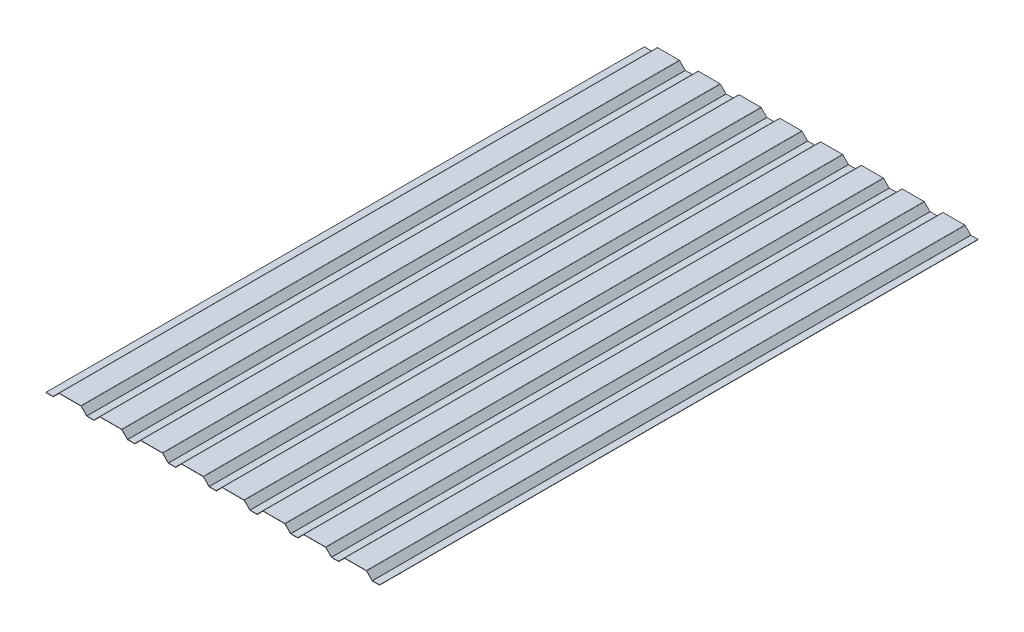
from build123d import *

# Parameters (mm, degrees)
SM_BASE_FLANGE_2_DEPTH = 2054.330661


# Sheet-metal steps are written as plain solids
with BuildPart() as part:
    # Эскиз1 → Базовая кромка2 (new body)
    with BuildSketch(Plane.XY):
        with BuildLine():
            Line((-572.5, 0), (-548.224873734, 0))
            ThreePointArc((-548.224873734, 0), (-547.555177728, 0.133210818), (-546.987436867, 0.512563133))
            Line((-546.987436867, 0.512563133), (-527.719669914, 19.780330086))
            ThreePointArc((-527.719669914, 19.780330086), (-527.476352403, 19.942909649), (-527.189339828, 20))
            Line((-527.189339828, 20), (-452.810660172, 20))
            ThreePointArc((-452.810660172, 20), (-452.523647598, 19.942909649), (-452.280330086, 19.780330086))
            Line((-452.280330086, 19.780330086), (-433.012563133, 0.512563133))
            ThreePointArc((-433.012563133, 0.512563133), (-432.444822272, 0.133210818), (-431.775126266, 0))
            Line((-431.775126266, 0), (-408.224873734, 0))
            ThreePointArc((-408.224873734, 0), (-407.555177728, 0.133210818), (-406.987436867, 0.512563133))
            Line((-406.987436867, 0.512563133), (-387.719669914, 19.780330086))
            ThreePointArc((-387.719669914, 19.780330086), (-387.476352402, 19.942909649), (-387.189339828, 20))
            Line((-387.189339828, 20), (-312.810660172, 20))
            ThreePointArc((-312.810660172, 20), (-312.523647598, 19.942909649), (-312.280330086, 19.780330086))
            Line((-312.280330086, 19.780330086), (-293.012563133, 0.512563133))
            ThreePointArc((-293.012563133, 0.512563133), (-292.444822272, 0.133210818), (-291.775126266, 0))
            Line((-291.775126266, 0), (-268.224873734, 0))
            ThreePointArc((-268.224873734, 0), (-267.555177728, 0.133210818), (-266.987436867, 0.512563133))
            Line((-266.987436867, 0.512563133), (-247.719669914, 19.780330086))
            ThreePointArc((-247.719669914, 19.780330086), (-247.476352402, 19.942909649), (-247.189339828, 20))
            Line((-247.189339828, 20), (-172.810660172, 20))
            ThreePointArc((-172.810660172, 20), (-172.523647598, 19.942909649), (-172.280330086, 19.780330086))
            Line((-172.280330086, 19.780330086), (-153.012563133, 0.512563133))
            ThreePointArc((-153.012563133, 0.512563133), (-152.444822272, 0.133210818), (-151.775126266, 0))
            Line((-151.775126266, 0), (-128.224873734, 0))
            ThreePointArc((-128.224873734, 0), (-127.555177728, 0.133210818), (-126.987436867, 0.512563133))
            Line((-126.987436867, 0.512563133), (-107.719669914, 19.780330086))
            ThreePointArc((-107.719669914, 19.780330086), (-107.476352402, 19.942909649), (-107.189339828, 20))
            Line((-107.189339828, 20), (-32.810660172, 20))
            ThreePointArc((-32.810660172, 20), (-32.523647598, 19.942909649), (-32.280330086, 19.780330086))
            Line((-32.280330086, 19.780330086), (-13.012563133, 0.512563133))
            ThreePointArc((-13.012563133, 0.512563133), (-12.444822272, 0.133210818), (-11.775126266, 0))
            Line((-11.775126266, 0), (0, 0))
            Line((0, 0), (0, 1))
            Line((0, 1), (-11.775126266, 1))
            ThreePointArc((-11.775126266, 1), (-12.06213884, 1.057090351), (-12.305456352, 1.219669914))
            Line((-12.305456352, 1.219669914), (-31.573223305, 20.487436867))
            ThreePointArc((-31.573223305, 20.487436867), (-32.140964165, 20.866789182), (-32.810660172, 21))
            Line((-32.810660172, 21), (-107.189339828, 21))
            ThreePointArc((-107.189339828, 21), (-107.859035835, 20.866789182), (-108.426776695, 20.487436867))
            Line((-108.426776695, 20.487436867), (-127.694543648, 1.219669914))
            ThreePointArc((-127.694543648, 1.219669914), (-127.93786116, 1.057090351), (-128.224873734, 1))
            Line((-128.224873734, 1), (-151.775126266, 1))
            ThreePointArc((-151.775126266, 1), (-152.06213884, 1.057090351), (-152.305456352, 1.219669914))
            Line((-152.305456352, 1.219669914), (-171.573223305, 20.487436867))
            ThreePointArc((-171.573223305, 20.487436867), (-172.140964165, 20.866789182), (-172.810660172, 21))
            Line((-172.810660172, 21), (-247.189339828, 21))
            ThreePointArc((-247.189339828, 21), (-247.859035835, 20.866789182), (-248.426776695, 20.487436867))
            Line((-248.426776695, 20.487436867), (-267.694543648, 1.219669914))
            ThreePointArc((-267.694543648, 1.219669914), (-267.93786116, 1.057090351), (-268.224873734, 1))
            Line((-268.224873734, 1), (-291.775126266, 1))
            ThreePointArc((-291.775126266, 1), (-292.06213884, 1.057090351), (-292.305456352, 1.219669914))
            Line((-292.305456352, 1.219669914), (-311.573223305, 20.487436867))
            ThreePointArc((-311.573223305, 20.487436867), (-312.140964165, 20.866789182), (-312.810660172, 21))
            Line((-312.810660172, 21), (-387.189339828, 21))
            ThreePointArc((-387.189339828, 21), (-387.859035835, 20.866789182), (-388.426776695, 20.487436867))
            Line((-388.426776695, 20.487436867), (-407.694543648, 1.219669914))
            ThreePointArc((-407.694543648, 1.219669914), (-407.93786116, 1.057090351), (-408.224873734, 1))
            Line((-408.224873734, 1), (-431.775126266, 1))
            ThreePointArc((-431.775126266, 1), (-432.06213884, 1.057090351), (-432.305456352, 1.219669914))
            Line((-432.305456352, 1.219669914), (-451.573223305, 20.487436867))
            ThreePointArc((-451.573223305, 20.487436867), (-452.140964165, 20.866789182), (-452.810660172, 21))
            Line((-452.810660172, 21), (-527.189339828, 21))
            ThreePointArc((-527.189339828, 21), (-527.859035835, 20.866789182), (-528.426776695, 20.487436867))
            Line((-528.426776695, 20.487436867), (-547.694543648, 1.219669914))
            ThreePointArc((-547.694543648, 1.219669914), (-547.93786116, 1.057090351), (-548.224873734, 1))
            Line((-548.224873734, 1), (-572.5, 1))
            Line((-572.5, 1), (-572.5, 0))
        make_face()
    extrude(amount=-SM_BASE_FLANGE_2_DEPTH)

    # Зеркальное отражение3: part across face


with BuildPart() as part_1:
    add(part.part)
    add(part.part.mirror(Plane(origin=(0, 0.5, -1027.1653305), x_dir=(0, 0, 1), z_dir=(1, 0, 0))))


solid = part_1.part
